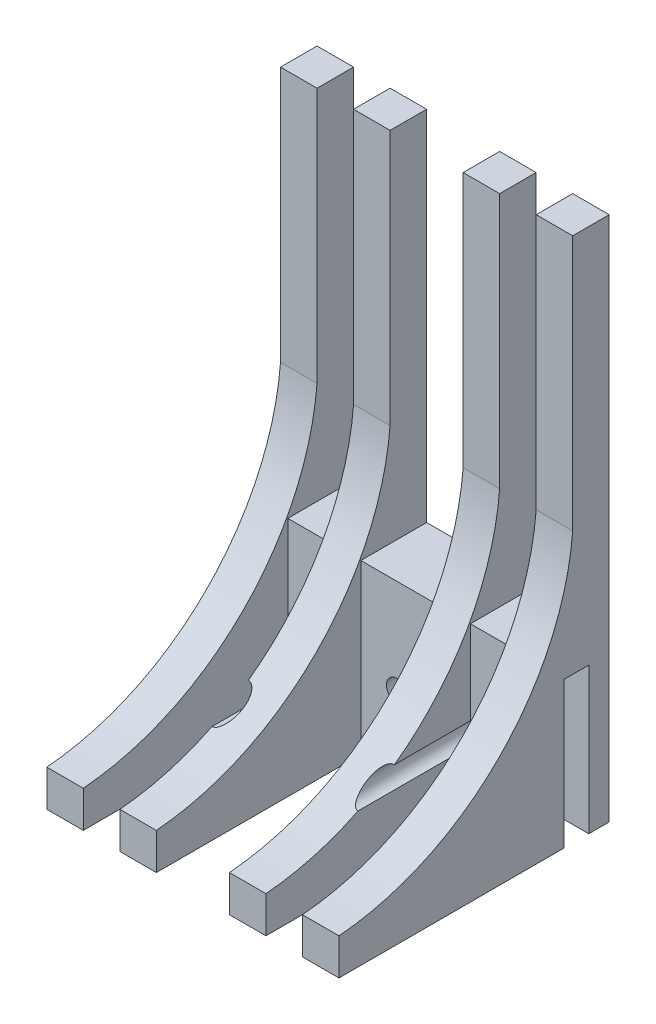
from build123d import *

# Parameters (mm, degrees)
BOSS_EXTRUDE1_DEPTH = 40
BOSS_EXTRUDE2_DEPTH = 5
LPATTERN1_COUNT     = 2
LPATTERN1_PITCH     = 10
SKETCH4_R           = 1.5
CUT_EXTRUDE2_DEPTH  = 91.293964361


# Read off the part's stored shape, not the designer's step: Mirror1
with BuildPart() as part:
    # Sketch1 → Boss-Extrude1 (new body)
    with BuildSketch(Plane(origin=(0, 0, 0), x_dir=(0, 0, -1), z_dir=(1, 0, 0))):
        Polygon((0, 0), (0, 23), (9, 23), (9, 0), (6.2, 0), (6.2, 20), (2.8, 20), (2.8, 0), align=None)
    extrude(amount=BOSS_EXTRUDE1_DEPTH)

    # Sketch3 → Boss-Extrude2 (add)
    with BuildSketch(Plane.ZY):
        with BuildLine():
            Line((0, 0), (28, 0))
            Line((28, 0), (28, 5))
            ThreePointArc((28, 5), (6.132470247, 15.132470247), (-4, 37))
            Line((-4, 37), (-4, 72))
            Line((-4, 72), (-9, 72))
            Line((-9, 72), (-9, 37))
            Line((-9, 37), (-9, 23))
            Line((-9, 23), (0, 23))
            Line((0, 23), (0, 0))
        make_face()
    boss_extrude2 = extrude(amount=-BOSS_EXTRUDE2_DEPTH)

    # LPattern1: Boss-Extrude2 ×2
    with Locations(*[(i * LPATTERN1_PITCH, 0, 0) for i in range(1, LPATTERN1_COUNT)]):
        add(boss_extrude2)

    # Sketch4 → Cut-Extrude2 (cut, through all)
    with BuildSketch(Plane(origin=(0, 0, -9), x_dir=(-1, 0, 0), z_dir=(0, 0, -1))):
        with Locations(Location((-10, 10, 0), (0, 0, 270))):
            Circle(SKETCH4_R)
        with Locations(Location((-20, 10, 0), (0, 0, 90))):
            Circle(SKETCH4_R)
        with Locations(Location((-30, 10, 0), (0, 0, 90))):
            Circle(SKETCH4_R)
    extrude(amount=-CUT_EXTRUDE2_DEPTH, mode=Mode.SUBTRACT)

    # Mirror1: part across plane


with BuildPart() as part_1:
    add(part.part)
    add(part.part.mirror(Plane.ZY.offset(-20)))


solid = part_1.part
